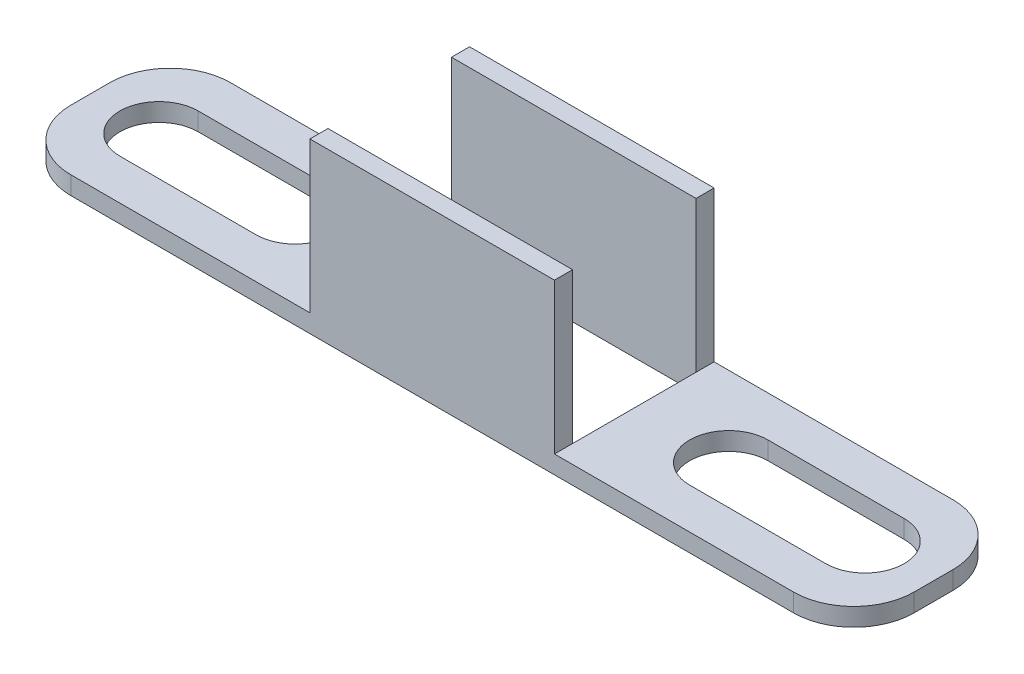
from build123d import *

# Parameters (mm, degrees)
SKETCH1_W           = 140
SKETCH1_H           = 26.5
SKETCH1_W_2         = 40.6
SKETCH1_H_2         = 20.5
BOSS_EXTRUDE1_DEPTH = 3
SKETCH2_W           = 40.6
SKETCH2_H           = 3
BOSS_EXTRUDE2_DEPTH = 25
FILLET1_R           = 10


with BuildPart() as part:
    # Sketch1 → Boss-Extrude1 (new body)
    with BuildSketch(Plane(origin=(0, 0, 0), x_dir=(1, 0, 0), z_dir=(0, 1, 0))):
        Rectangle(SKETCH1_W, SKETCH1_H)
        Rectangle(SKETCH1_W_2, SKETCH1_H_2, mode=Mode.SUBTRACT)
        with BuildLine():
            Line((36, 6.5), (58.6, 6.5))
            ThreePointArc((58.6, 6.5), (65.1, 0), (58.6, -6.5))
            Line((58.6, -6.5), (36, -6.5))
            ThreePointArc((36, -6.5), (29.5, 0), (36, 6.5))
        make_face(mode=Mode.SUBTRACT)
        with BuildLine():
            Line((-36, -6.5), (-58.6, -6.5))
            ThreePointArc((-58.6, -6.5), (-65.1, 0), (-58.6, 6.5))
            Line((-58.6, 6.5), (-36, 6.5))
            ThreePointArc((-36, 6.5), (-29.5, 0), (-36, -6.5))
        make_face(mode=Mode.SUBTRACT)
    extrude(amount=BOSS_EXTRUDE1_DEPTH)

    # Sketch2 → Boss-Extrude2 (add)
    with BuildSketch(Plane(origin=(0, 3, 0), x_dir=(1, 0, 0), z_dir=(0, 1, 0))):
        with Locations((0, -11.75)):
            Rectangle(SKETCH2_W, SKETCH2_H)
        with Locations((0, 11.75)):
            Rectangle(SKETCH2_W, SKETCH2_H)
    extrude(amount=BOSS_EXTRUDE2_DEPTH)

    # Fillet1
    fillet1_edges = [part.edges().sort_by_distance(p)[0] for p in [
        (70, 1.5, -13.25),
        (70, 1.5, 13.25),
        (-70, 1.5, -13.25),
        (-70, 1.5, 13.25),
    ]]
    fillet(fillet1_edges, radius=FILLET1_R)


solid = part.part
